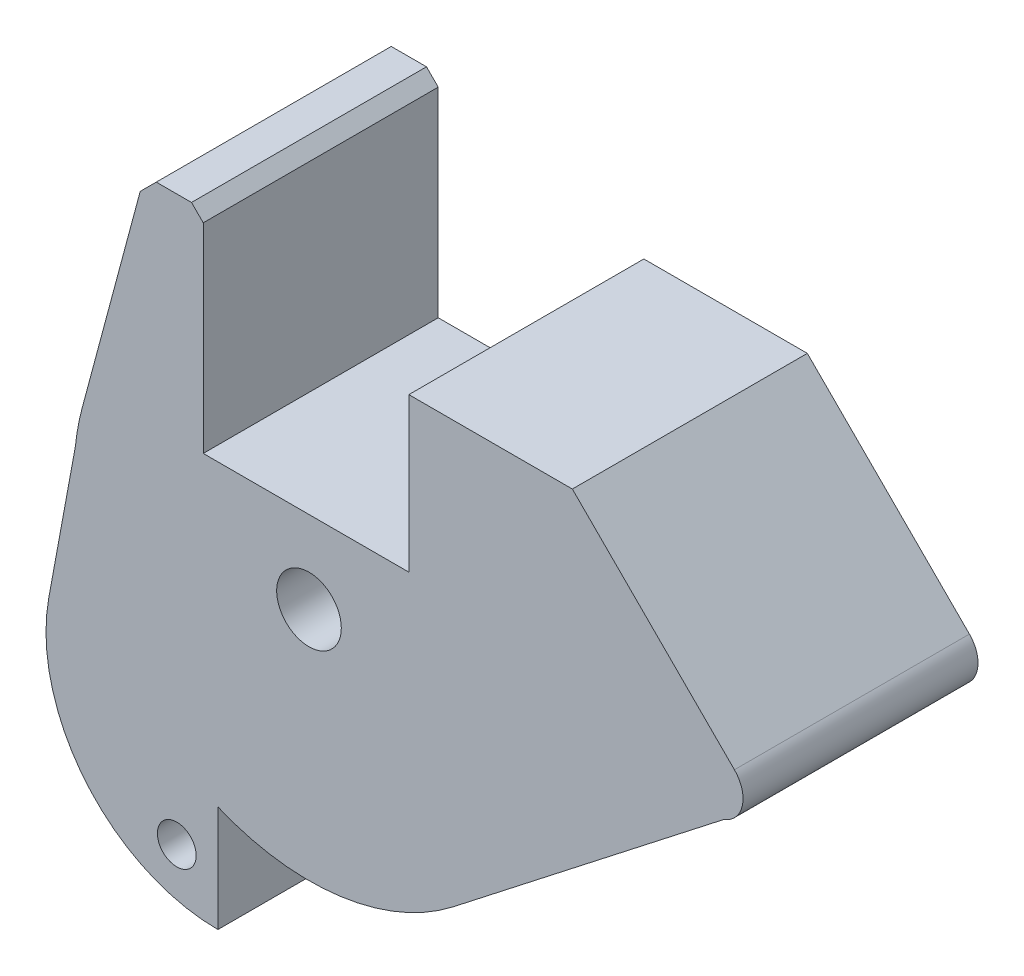
from build123d import *
from OCP.BRepFilletAPI import BRepFilletAPI_MakeChamfer

# Parameters (mm, degrees)
SKETCH_1_R          = 2.75
EXTRUDE_1_DEPTH     = 20
CHAMFER_1_SIZE      = 1
CHAMFER_1_SIZE2     = 1.414213562
FILLET_1_R          = 2.5
SKETCH_2_W          = 28.23976686
SKETCH_2_H          = 12.215936495
CUT_EXTRUDE_1_DEPTH = 57.915812899
EXTRUDE_START       = -10
EXTRUDE_2_DEPTH     = 10
SKETCH_4_R          = 1.65
CUT_EXTRUDE_2_DEPTH = 10


with BuildPart() as part:
    # 草图1 → 凸台-拉伸1 (new body)
    with BuildSketch(Plane.XY):
        with BuildLine():
            Line((0, 0), (0, 18))
            Line((0, 18), (-5, 18))
            Line((-5, 18), (-10.312177826, -1.825317547))
            ThreePointArc((-10.312177826, -1.825317547), (-2.044709461, -23.66589163), (21.291049633, -22.769199403))
            Line((21.291049633, -22.769199403), (44.319805153, -4.819805153))
            Line((44.319805153, -4.819805153), (49.319805153, -4.819805153))
            Line((49.319805153, -4.819805153), (17.5, 27))
            Line((17.5, 27), (17.5, 0))
            Line((17.5, 0), (0, 0))
        make_face()
        with Locations((9, -7)):
            Circle(SKETCH_1_R, mode=Mode.SUBTRACT)
    extrude(amount=EXTRUDE_1_DEPTH)

    # 倒角1: one chamfer whose edges measure the first distance from different faces: ONE call of the kernel's chamfer builder (chamfer() names one face for all edges)
    chamfer_1_edges_1 = [part.edges().sort_by_distance(p)[0] for p in [
        (-5, 18, 10),
    ]]
    chamfer_1_side_1 = [part.faces().sort_by_distance(p)[0] for p in [
        (-2.5, 18, 10),
    ]]
    chamfer_1_edges_2 = [part.edges().sort_by_distance(p)[0] for p in [
        (0, 18, 10),
    ]]
    chamfer_1 = BRepFilletAPI_MakeChamfer(part.part.solid().wrapped)
    for e in chamfer_1_edges_1:
        chamfer_1.Add(CHAMFER_1_SIZE, CHAMFER_1_SIZE2, e.wrapped, chamfer_1_side_1[0].wrapped)  # the first distance lies on this face
    for e in chamfer_1_edges_2:
        chamfer_1.Add(CHAMFER_1_SIZE, e.wrapped)
    add(Compound.cast(chamfer_1.Shape()), mode=Mode.REPLACE)

    # 圆角1
    # the kernel refuses this fillet: 2.5 mm, written as the material it takes off along each edge
    with BuildSketch(Plane(origin=(17.5, 27, -15.088834765), x_dir=(0, -1, 0), z_dir=(0, 0, 1))) as fillet_1_piece_1:
        with BuildLine():
            CenterArc((FILLET_1_R * 2.41421356237, FILLET_1_R), FILLET_1_R, 135, 135)
            Line((FILLET_1_R * 1.70710678119, FILLET_1_R * 1.70710678119), (FILLET_1_R * 1.69296464556, FILLET_1_R * 1.72124891681))
            Line((FILLET_1_R * 1.69296464556, FILLET_1_R * 1.72124891681), (-FILLET_1_R * 0.0141421356237, FILLET_1_R * 0.0141421356237))
            Line((-FILLET_1_R * 0.0141421356237, FILLET_1_R * 0.0141421356237), (0, -FILLET_1_R * 0.02))
            Line((0, -FILLET_1_R * 0.02), (FILLET_1_R * 2.41421356237, -FILLET_1_R * 0.02))
            Line((FILLET_1_R * 2.41421356237, -FILLET_1_R * 0.02), (FILLET_1_R * 2.41421356237, 0))
        make_face()
    extrude(amount=50.17766953, mode=Mode.SUBTRACT)
    with BuildSketch(Plane(origin=(49.319805153, -4.819805153, -14.527458022), x_dir=(-0.7071067811865513, 0.7071067811865437, 0), z_dir=(0, 0, 1))) as fillet_1_piece_2:
        with BuildLine():
            CenterArc((5.810983209, 2.5), FILLET_1_R, 155.530199479, 114.469800521)
            Line((3.535533906, 3.535533906), (3.49002492, 3.556244584))
            ThreePointArc((3.49002492, 3.556244584), (1.732411614, 1.803122292), (-0.035355339, 0.035355339))
            Line((-0.035355339, 0.035355339), (0, -0.05))
            Line((0, -0.05), (5.810983209, -0.05))
            Line((5.810983209, -0.05), (5.810983209, 0))
        make_face()
    extrude(amount=49.054916044, mode=Mode.SUBTRACT)

    # 草图2 → 切除-拉伸1 (cut, through all)
    with BuildSketch(Plane.XY.offset(20)):
        with Locations((31.61988343, 19.192534099)):
            Rectangle(SKETCH_2_W, SKETCH_2_H)
    extrude(amount=-CUT_EXTRUDE_1_DEPTH, mode=Mode.SUBTRACT)

    # 草图3 → 凸台-拉伸2 (add)
    with BuildSketch(Plane.XY.offset(20).offset(EXTRUDE_START)):
        with BuildLine():
            ThreePointArc((21.291049633, -22.769199403), (-0.684147296, -24.491564883), (-10.888388441, -4.953159484))
            Line((-10.888388441, -4.953159484), (-13.142676364, -17.190102226))
            ThreePointArc((-13.142676364, -17.190102226), (-6.344046, -32.349558271), (10.241880352, -31.381297238))
            Line((10.241880352, -31.381297238), (21.291049633, -22.769199403))
        make_face()
    extrude(amount=EXTRUDE_2_DEPTH)

    # 草图4 → 切除-拉伸2 (cut)
    with BuildSketch(Plane(origin=(0, 0, 10), x_dir=(-1, 0, 0), z_dir=(0, 0, -1))):
        with Locations((2.25305307, -29.950852035)):
            Circle(SKETCH_4_R)
        with BuildLine():
            Line((-1.24694693, -34.472712807), (-1.24694693, -25.428991263))
            ThreePointArc((-1.24694693, -25.428991263), (-11.630014522, -26.819701675), (-21.291049633, -22.769199403))
            Line((-21.291049633, -22.769199403), (-10.241880352, -31.381297238))
            ThreePointArc((-10.241880352, -31.381297238), (-6.002619266, -33.678292696), (-1.24694693, -34.472712807))
        make_face()
    extrude(amount=-CUT_EXTRUDE_2_DEPTH, mode=Mode.SUBTRACT)


solid = part.part
